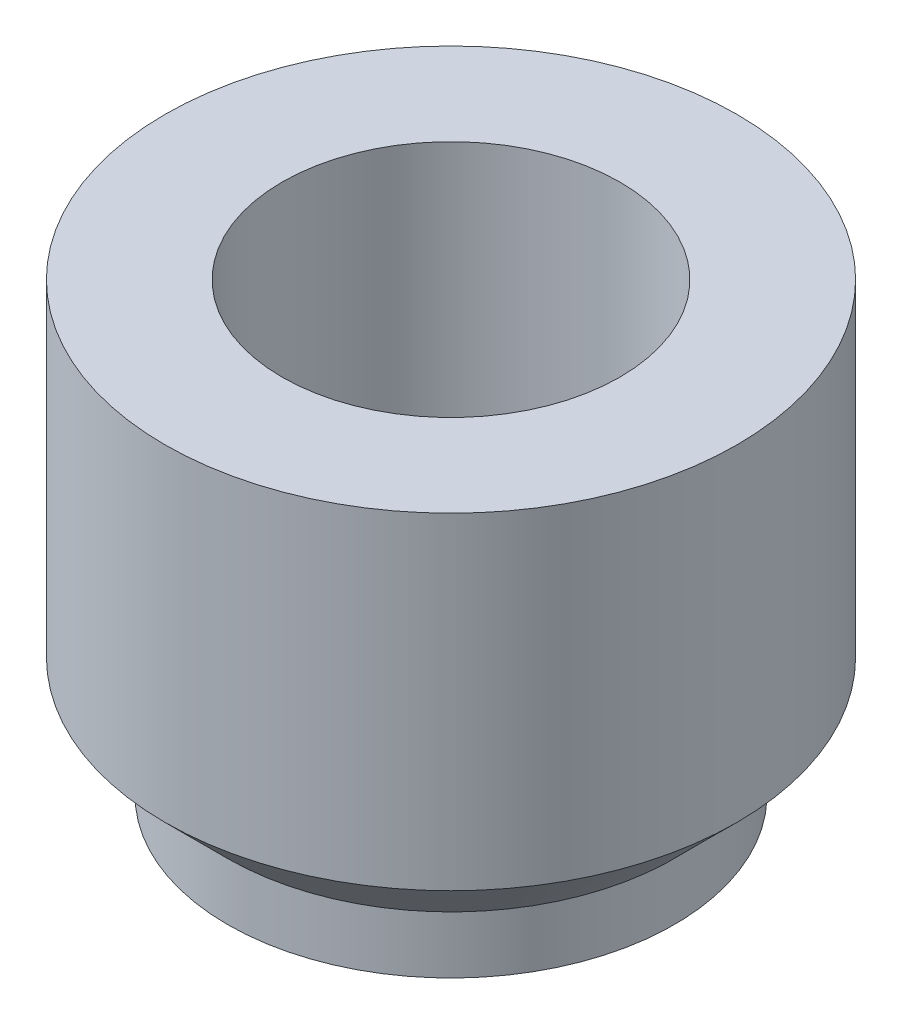
from build123d import *

# Parameters (mm, degrees)
SKETCH1_R           = 4.1
SKETCH1_R_2         = 2.1
BOSS_EXTRUDE1_DEPTH = 2.2
SKETCH2_R           = 5.25
BOSS_EXTRUDE2_DEPTH = 1
SKETCH3_R           = 5.25
SKETCH3_R_2         = 3.1
BOSS_EXTRUDE3_DEPTH = 5
CHAMFER1_SIZE       = 1.15


with BuildPart() as part:
    # Sketch1 → Boss-Extrude1 (new body)
    with BuildSketch(Plane(origin=(0, 0, 0), x_dir=(1, 0, 0), z_dir=(0, 1, 0))):
        with Locations(Location((0, 0, 0), (0, 0, 270))):
            Circle(SKETCH1_R)
        with Locations(Location((0, 0, 0), (0, 0, 270))):
            Circle(SKETCH1_R_2, mode=Mode.SUBTRACT)
    extrude(amount=BOSS_EXTRUDE1_DEPTH)

    # Sketch2 → Boss-Extrude2 (add)
    with BuildSketch(Plane(origin=(0, 2.2, 0), x_dir=(1, 0, 0), z_dir=(0, 1, 0))):
        with Locations(Location((0, 0, 0), (0, 0, 270))):
            Circle(SKETCH2_R)
    extrude(amount=BOSS_EXTRUDE2_DEPTH)

    # Sketch3 → Boss-Extrude3 (add)
    with BuildSketch(Plane(origin=(0, 3.2, 0), x_dir=(1, 0, 0), z_dir=(0, 1, 0))):
        with Locations(Location((0, 0, 0), (0, 0, 270))):
            Circle(SKETCH3_R)
        with Locations(Location((0, 0, 0), (0, 0, 270))):
            Circle(SKETCH3_R_2, mode=Mode.SUBTRACT)
    extrude(amount=BOSS_EXTRUDE3_DEPTH)

    # Chamfer1
    chamfer1_edges = [part.edges().sort_by_distance(p)[0] for p in [
        (0, 2.2, -4.1),
    ]]
    chamfer(chamfer1_edges, length=CHAMFER1_SIZE - 0.0001)  # a hair under: the kernel refuses the full size


solid = part.part
